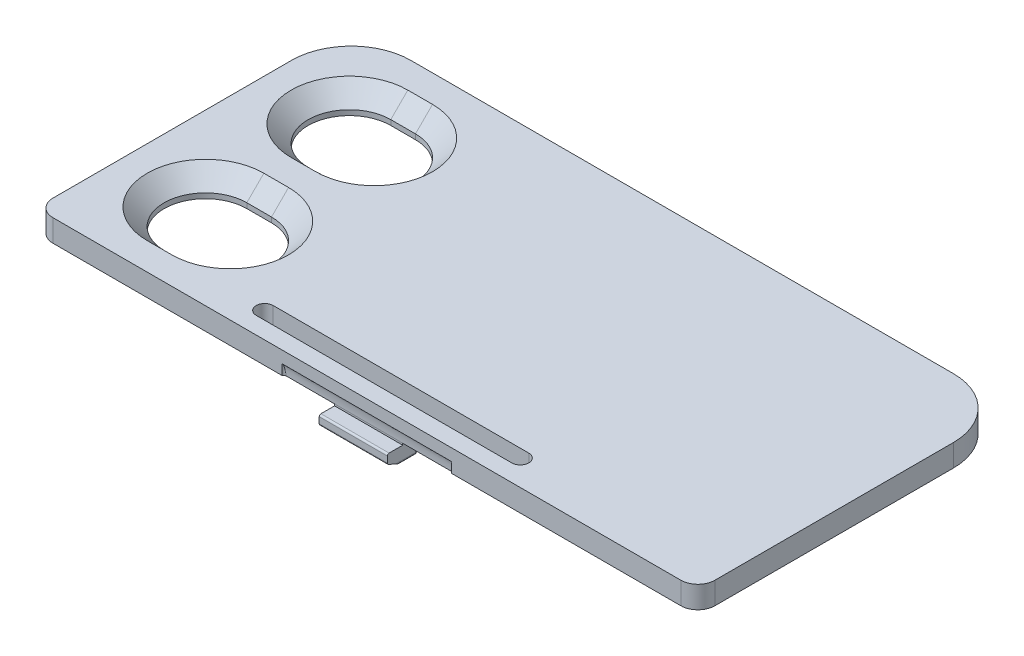
from build123d import *

# Parameters (mm, degrees)
SKETCH1_W           = 3.5
SKETCH1_H           = 1
SKETCH1_W_2         = 4
BOSS_EXTRUDE1_DEPTH = 1.3
SKETCH1_7_W         = 3.5
SKETCH1_7_H         = 1
BOSS_EXTRUDE3_DEPTH = 1
SKETCH1_8_W         = 4
SKETCH1_8_H         = 1
BOSS_EXTRUDE4_DEPTH = 1
FILLET2_R           = 1
SKETCH5_W           = 1.00602476
SKETCH5_H           = 0.93
BOSS_EXTRUDE5_DEPTH = 4
SKETCH7_W           = 1.00602476
SKETCH7_H           = 0.93
BOSS_EXTRUDE6_DEPTH = 3.5
BOSS_EXTRUDE7_DEPTH = 1
BOSS_EXTRUDE8_START = 1.3
BOSS_EXTRUDE8_DEPTH = 0.7
FILLET6_START       = -4.975
FILLET6_DEPTH       = 9.95
FILLET7_R           = 0.15
SKETCH10_W          = 0.9
SKETCH10_H          = 0.9
BOSS_EXTRUDE9_DEPTH = 4
CHAMFER2_SIZE       = 0.8
CHAMFER2_SIZE2      = 0.373046127
FILLET9_R           = 0.15
FILLET10_R          = 0.1
CHAMFER5_SIZE       = 1


with BuildPart() as part:
    # Sketch1 → Boss-Extrude1 (new body)
    # profile 1 of 4: a face of its own
    with BuildSketch(Plane(origin=(0, 0, 0), x_dir=(1, 0, 0), z_dir=(0, 1, 0))):
        with BuildLine():
            Line((0, 9.25), (-4.925, 9.25))
            Line((-4.925, 9.25), (-4.925, 8.25))
            Line((-4.925, 8.25), (-8.425, 8.25))
            Line((-8.425, 8.25), (-8.425, 9.25))
            Line((-8.425, 9.25), (-15.925, 9.25))
            ThreePointArc((-15.925, 9.25), (-18.399873734, 8.224873734), (-19.425, 5.75))
            Line((-19.425, 5.75), (-19.425, -8.25))
            ThreePointArc((-19.425, -8.25), (-19.132106781, -8.957106781), (-18.425, -9.25))
            Line((-18.425, -9.25), (-8, -9.25))
            Line((-8, -9.25), (-4.975, -9.25))
            Line((-4.975, -9.25), (-4.975, -9.15))
            Line((-4.975, -9.15), (-2, -9.15))
            Line((-2, -9.15), (-2, -8.75))
            Line((-2, -8.75), (-2, -8.25))
            Line((-2, -8.25), (-7.5, -8.25))
            ThreePointArc((-7.5, -8.25), (-8, -7.75), (-7.5, -7.25))
            Line((-7.5, -7.25), (7.5, -7.25))
            ThreePointArc((7.5, -7.25), (8, -7.75), (7.5, -8.25))
            Line((7.5, -8.25), (2, -8.25))
            Line((2, -8.25), (2, -8.75))
            Line((2, -8.75), (2, -9.15))
            Line((2, -9.15), (4.975, -9.15))
            Line((4.975, -9.15), (4.975, -9.25))
            Line((4.975, -9.25), (8, -9.25))
            Line((8, -9.25), (18.425, -9.25))
            ThreePointArc((18.425, -9.25), (19.132106781, -8.957106781), (19.425, -8.25))
            Line((19.425, -8.25), (19.425, 5.75))
            ThreePointArc((19.425, 5.75), (18.399873734, 8.224873734), (15.925, 9.25))
            Line((15.925, 9.25), (9.675, 9.25))
            Line((9.675, 9.25), (9.675, 8.25))
            Line((9.675, 8.25), (5.675, 8.25))
            Line((5.675, 8.25), (5.675, 9.25))
            Line((5.675, 9.25), (0, 9.25))
        make_face()
        with BuildLine():
            Line((-13.05, -6.65), (-14.5, -6.65))
            ThreePointArc((-14.5, -6.65), (-16.214733944, -5.939733944), (-16.925, -4.225))
            ThreePointArc((-16.925, -4.225), (-16.214733944, -2.510266056), (-14.5, -1.8))
            Line((-14.5, -1.8), (-13.05, -1.8))
            ThreePointArc((-13.05, -1.8), (-11.335266056, -2.510266056), (-10.625, -4.225))
            ThreePointArc((-10.625, -4.225), (-11.335266056, -5.939733944), (-13.05, -6.65))
        make_face(mode=Mode.SUBTRACT)
        with BuildLine():
            ThreePointArc((-16.925, 4.225), (-16.214733944, 5.939733944), (-14.5, 6.65))
            Line((-14.5, 6.65), (-13.05, 6.65))
            ThreePointArc((-13.05, 6.65), (-11.335266056, 5.939733944), (-10.625, 4.225))
            ThreePointArc((-10.625, 4.225), (-11.335266056, 2.510266056), (-13.05, 1.8))
            Line((-13.05, 1.8), (-14.5, 1.8))
            ThreePointArc((-14.5, 1.8), (-16.214733944, 2.510266056), (-16.925, 4.225))
        make_face(mode=Mode.SUBTRACT)
    # profile 2 of 4: a face of its own
    with BuildSketch(Plane(origin=(0, 0, 0), x_dir=(1, 0, 0), z_dir=(0, 1, 0))):
        with Locations((-6.675, 8.75)):
            Rectangle(SKETCH1_W, SKETCH1_H)
    # profile 3 of 4: a face of its own
    with BuildSketch(Plane(origin=(0, 0, 0), x_dir=(1, 0, 0), z_dir=(0, 1, 0))):
        with Locations((7.675, 8.75)):
            Rectangle(SKETCH1_W_2, SKETCH1_H)
    # profile 4 of 4: a face of its own
    with BuildSketch(Plane(origin=(0, 0, 0), x_dir=(1, 0, 0), z_dir=(0, 1, 0))):
        Polygon((-2, -8.75), (-2, -9.15), (2, -9.15), (2, -8.75), (2, -8.25), (-2, -8.25), align=None)
    extrude(amount=BOSS_EXTRUDE1_DEPTH)

    # Sketch1<7> → Boss-Extrude3 (add)
    with BuildSketch(Plane(origin=(0, 0, 0), x_dir=(1, 0, 0), z_dir=(0, 1, 0))):
        with Locations((-6.675, 8.75)):
            Rectangle(SKETCH1_7_W, SKETCH1_7_H)
    extrude(amount=-BOSS_EXTRUDE3_DEPTH)

    # Sketch1<8> → Boss-Extrude4 (add)
    with BuildSketch(Plane(origin=(0, 0, 0), x_dir=(1, 0, 0), z_dir=(0, 1, 0))):
        with Locations((7.675, 8.75)):
            Rectangle(SKETCH1_8_W, SKETCH1_8_H)
    extrude(amount=-BOSS_EXTRUDE4_DEPTH)

    # Fillet2
    fillet2_edges = [part.edges().sort_by_distance(p)[0] for p in [
        (7.675, -1, -8.25),
        (-6.675, -1, -8.25),
    ]]
    fillet(fillet2_edges, radius=FILLET2_R - 0.0001)  # a hair under: the kernel refuses the full size

    # Sketch5 → Boss-Extrude5 (add)
    with BuildSketch(Plane.ZY.offset(-9.675)):
        with Locations((-9.75301238, -0.535)):
            Rectangle(SKETCH5_W, SKETCH5_H)
    extrude(amount=BOSS_EXTRUDE5_DEPTH)

    # Sketch7 → Boss-Extrude6 (add)
    with BuildSketch(Plane.ZY.offset(8.425)):
        with Locations((-9.75301238, -0.535)):
            Rectangle(SKETCH7_W, SKETCH7_H)
    extrude(amount=-BOSS_EXTRUDE6_DEPTH)

    # Sketch1<12> → Boss-Extrude7 (add)
    with BuildSketch(Plane(origin=(0, 0, 0), x_dir=(1, 0, 0), z_dir=(0, 1, 0))):
        Polygon((-2, -8.75), (-2, -9.15), (2, -9.15), (2, -8.75), (2, -8.25), (-2, -8.25), align=None)
    extrude(amount=-BOSS_EXTRUDE7_DEPTH)

    # Sketch1<13> → Boss-Extrude8 (add)
    with BuildSketch(Plane(origin=(0, 0, 0), x_dir=(1, 0, 0), z_dir=(0, 1, 0)).offset(BOSS_EXTRUDE8_START)):
        Polygon((-4.975, -9.15), (-4.975, -9.25), (0, -9.25), (4.975, -9.25), (4.975, -9.15), (2, -9.15), (-2, -9.15), align=None)
    extrude(amount=-BOSS_EXTRUDE8_DEPTH)

    # Fillet6: read off the stored shape, not the designer's step
    # Fillet6 outline → Fillet6 (add)
    with BuildSketch(Plane.YZ.offset(FILLET6_START)):
        with BuildLine():
            Line((0.6, 9.15), (0.6, 9.25))
            add(Edge.make_bspline(
                [(0.6, 9.25), (0.59163758, 9.15), (0.002086963, 9.15)],
                knots=[0, 0, 0, 1, 1, 1], degree=2, weights=[1, 0.735980072, 1]))
            Line((0.002086963, 9.15), (0.6, 9.15))
        make_face()
    extrude(amount=FILLET6_DEPTH)

    # Fillet7
    # the kernel refuses this fillet: 0.15 mm, written as the material it adds along each edge
    with BuildSketch(Plane(origin=(-4.975, 0, 9.15), x_dir=(1, 0, 0), z_dir=(0, 1, 0))) as fillet7_piece_1:
        with BuildLine():
            CenterArc((0.141421356, -0.15), FILLET7_R, 90, 70.528779366)
            Line((0, -0.1), (-0.002828427, -0.099))
            ThreePointArc((-0.002828427, -0.099), (-0.003, -0.05), (-0.003, 0))
            Line((-0.003, 0), (0, 0.003))
            Line((0, 0.003), (0.141421356, 0.003))
            Line((0.141421356, 0.003), (0.141421356, 0))
        make_face()
    extrude(amount=0.603127727)
    with BuildSketch(Plane(origin=(4.975, 0, 9.15), x_dir=(0, 0, 1), z_dir=(0, 1, 0))) as fillet7_piece_2:
        with BuildLine():
            CenterArc((0.15, -0.141421356), FILLET7_R, 109.471220634, 70.528779366)
            Line((0, -0.141421356), (-0.003, -0.141421356))
            Line((-0.003, -0.141421356), (-0.003, 0))
            Line((-0.003, 0), (0, 0.003))
            ThreePointArc((0, 0.003), (0.05, 0.003), (0.099, 0.002828427))
            Line((0.099, 0.002828427), (0.1, 0))
        make_face()
    extrude(amount=0.603127727)

    # Sketch10 → Boss-Extrude9 (add)
    with BuildSketch(Plane(origin=(2, 0, 0), x_dir=(0, 0, -1), z_dir=(1, 0, 0))):
        with Locations((-9.6, -0.55)):
            Rectangle(SKETCH10_W, SKETCH10_H)
    extrude(amount=-BOSS_EXTRUDE9_DEPTH)

    # Chamfer2
    chamfer2_edges = [part.edges().sort_by_distance(p)[0] for p in [
        (0, -1, 10.05),
    ]]
    chamfer2_side = [part.faces().sort_by_distance(p)[0] for p in [
        (0, -1, 9.15),
    ]]
    chamfer(chamfer2_edges, length=CHAMFER2_SIZE, length2=CHAMFER2_SIZE2, reference=chamfer2_side[0])

    # Fillet9
    fillet9_edges = [part.edges().sort_by_distance(p)[0] for p in [
        (-2, -0.5, 8.25),
        (2, -0.5, 8.25),
        (0, -1, 8.25),
        (2, -1, 8.75),
        (-2, -1, 8.75),
    ]]
    fillet(fillet9_edges, radius=FILLET9_R)

    # Fillet10
    fillet10_edges = [part.edges().sort_by_distance(p)[0] for p in [
        (0, -0.1, 10.05),
        (0, -0.626953873, 10.05),
    ]]
    fillet(fillet10_edges, radius=FILLET10_R)

    # Chamfer5
    chamfer5_edges = [part.edges().sort_by_distance(p)[0] for p in [
        (-10.625, 1.3, -4.225),
        (-13.775, 1.3, -1.8),
        (-16.925, 1.3, -4.225),
        (-13.775, 1.3, -6.65),
        (-16.925, 1.3, 4.225),
        (-13.775, 1.3, 1.8),
        (-10.625, 1.3, 4.225),
        (-13.775, 1.3, 6.65),
    ]]
    chamfer(chamfer5_edges, length=CHAMFER5_SIZE)


solid = part.part
